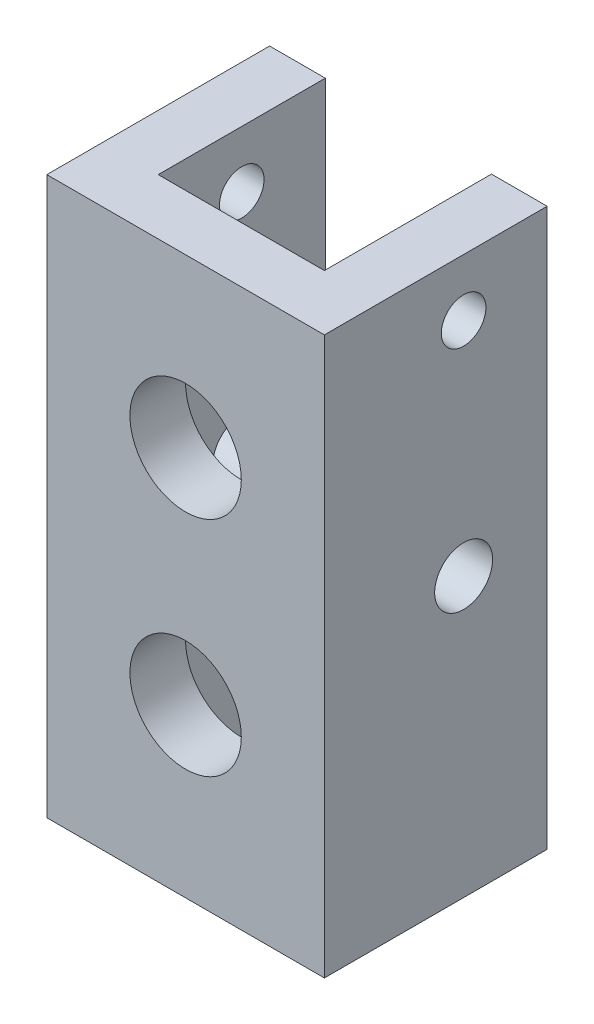
from build123d import *

# Parameters (mm, degrees)
BOSS_EXTRUDE1_DEPTH     = 63.5
SKETCH2_R               = 6.35
CUT_EXTRUDE1_DEPTH      = 76.357676181
CUT_EXTRUDE2_DEPTH      = 73.919254774
CUT_EXTRUDE2_DEPTH_BACK = 73.919254774
SKETCH5_R               = 3.302
SKETCH5_R_2             = 2.54


with BuildPart() as part:
    # Sketch1 → Boss-Extrude1 (new body)
    with BuildSketch(Plane(origin=(0, 0, 0), x_dir=(1, 0, 0), z_dir=(0, 1, 0))):
        Polygon((0, 0), (0, 25.4), (6.35, 25.4), (6.35, 6.35), (25.294420667, 6.35), (25.294420667, 25.4), (31.644420667, 25.4), (31.644420667, 0), align=None)
    extrude(amount=BOSS_EXTRUDE1_DEPTH)

    # Sketch2 → Cut-Extrude1 (cut, through all)
    with BuildSketch(Plane.XY):
        with Locations((15.822210333, 44.45)):
            Circle(SKETCH2_R)
        with Locations((15.822210333, 19.05)):
            Circle(SKETCH2_R)
    extrude(amount=-CUT_EXTRUDE1_DEPTH, mode=Mode.SUBTRACT)

    # Sketch5 → Cut-Extrude2 (cut, two sides: drawn at the far end of the back side and taken through both)
    with BuildSketch(Plane(origin=(6.35, 0, 0), x_dir=(0, 0, -1), z_dir=(1, 0, 0)).offset(-CUT_EXTRUDE2_DEPTH_BACK)):
        with Locations((15.875, 31.75)):
            Circle(SKETCH5_R)
        with Locations((15.875, 56.989992478)):
            Circle(SKETCH5_R_2)
    extrude(amount=CUT_EXTRUDE2_DEPTH + CUT_EXTRUDE2_DEPTH_BACK, mode=Mode.SUBTRACT)


solid = part.part
